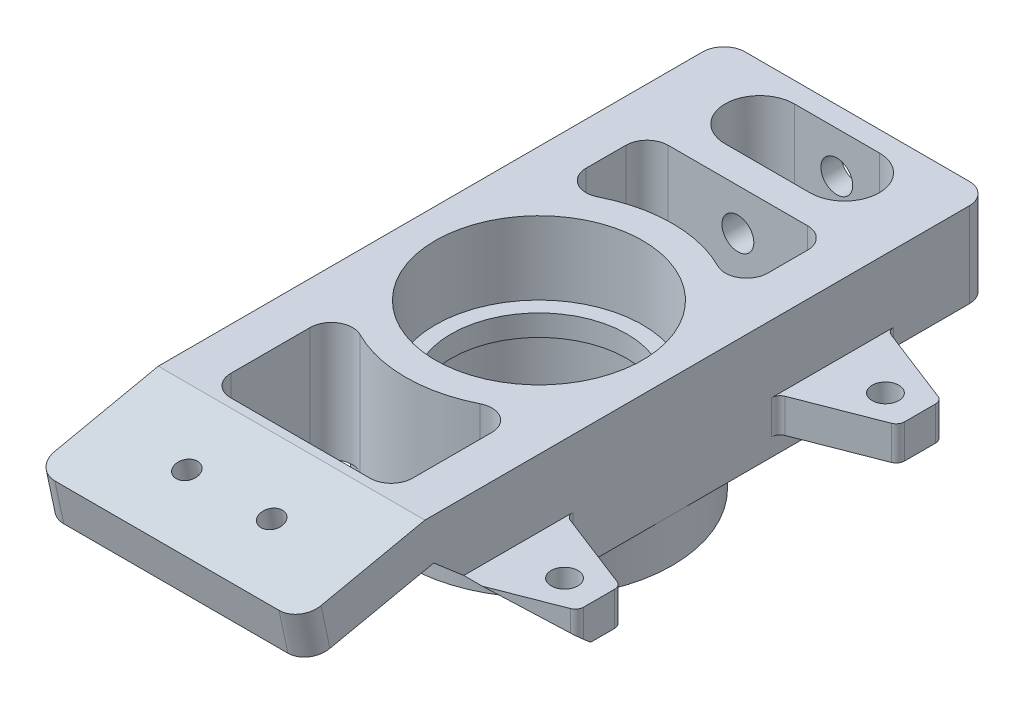
from build123d import *

# Parameters (mm, degrees)
BEARING_FILLET_R         = 6.35
LBJ_PREP_DEPTH           = 35.56
LBJ_EXTRUDE_DEPTH        = 79.756
LBJ_SLOT_DEPTH           = 107.720983645
LBJ_WEIGHT_SAIVNG_REACH  = 111.157
LBJ_FILLET_R             = 6.35
LBJ_HOLE_REACH           = 156.327
SKETCH12_R               = 4.7625
LBJ_WIDENING_DEPTH       = 147.443500502
UBJ_AREA_PREP_DEPTH      = 35.56
UBJ_ANGLE_MOUNT_DEPTH    = 79.756
SKETCH7_R                = 3.2639
CAMBER_BLOCK_HOLES_DEPTH = 12.7
UBJ_WEIGHT_SAVING_REACH  = 125.43
UBJ_FILLETS_R            = 6.35
SKETCH13_R               = 4
BRAKE_ARMS_DEPTH         = 10.16
UPPER_BRAKE_CUT_DEPTH    = 151.749278078
LOWER_BRAKE_CUT_DEPTH    = 151.749278078
FILLET1_R                = 2.54
SKETCH14_R               = 3.175
TIE_ROD_MOUND_DEPTH      = 6.35
FILLET2_R                = 6.35


with BuildPart() as part:
    # Sketch1 → Bearing Housing (revolve)
    with BuildSketch(Plane.XY):
        Polygon((-30.99943, -10.54248), (-30.99943, -32.38648), (-26.289, -32.38648), (-26.289, -38.73648), (-30.99943, -38.73648), (-30.99943, -63.12048), (-32.258, -63.12048), (-32.258, -59.31048), (-39.878, -59.31048), (-39.878, -10.54248), align=None)
    revolve(axis=Axis((0, 0, 0), (0, -1, 0)))

    # Bearing Fillet
    # the kernel refuses this fillet: 6.35 mm, written as the material it adds along each edge
    with BuildSketch(Plane(origin=(0, -59.31048, 0), x_dir=(-1, 0, 0), z_dir=(0, 0, 1))) as bearing_fillet_piece_1:
        with BuildLine():
            CenterArc((38.077871133, 6.35), BEARING_FILLET_R, 203.578178478, 66.421821522)
            Line((38.077871133, 0), (38.077871133, -0.127))
            Line((38.077871133, -0.127), (32.258, -0.127))
            Line((32.258, -0.127), (32.131, 0))
            ThreePointArc((32.131, 0), (32.131, 1.905), (32.141602577, 3.7592))
            Line((32.141602577, 3.7592), (32.258, 3.81))
        make_face()
    revolve(axis=Axis((0, -59.31048, 0), (0, -1, 0)))

    # Sketch2 → LBJ Prep (add)
    with BuildSketch(Plane(origin=(0, -10.54248, 0), x_dir=(-1, 0, 0), z_dir=(0, -1, 0))):
        with BuildLine():
            Line((-39.878, 50.8), (-39.878, 0))
            ThreePointArc((-39.878, 0), (0, 39.878), (39.878, 0))
            Line((39.878, 0), (39.878, 50.8))
            Line((39.878, 50.8), (-39.878, 50.8))
        make_face()
    extrude(amount=LBJ_PREP_DEPTH)

    # Sketch3 → LBJ Extrude (add)
    with BuildSketch(Plane.ZY.offset(39.878)):
        Polygon((-50.8, -10.54248), (-95.1865, -10.54248), (-95.1865, -35.94248), (-58.42, -35.94248), (-50.8, -46.10248), align=None)
    extrude(amount=-LBJ_EXTRUDE_DEPTH)

    # Sketch4 → LBJ Slot (cut, through all)
    with BuildSketch(Plane.XZ.offset(35.94248)):
        with BuildLine():
            Line((-12.7, -68.3895), (12.7, -68.3895))
            ThreePointArc((12.7, -68.3895), (23.0505, -78.74), (12.7, -89.0905))
            Line((12.7, -89.0905), (-12.7, -89.0905))
            ThreePointArc((-12.7, -89.0905), (-23.0505, -78.74), (-12.7, -68.3895))
        make_face()
    extrude(amount=-LBJ_SLOT_DEPTH, mode=Mode.SUBTRACT)

    # Sketch8 → LBJ Weight Saivng (cut, up to next)
    with BuildSketch(Plane.XZ.offset(46.10248), mode=Mode.PRIVATE) as lbj_weight_saivng_sk1:
        with BuildLine():
            Line((-27.178, -29.182378244), (-27.178, -59.4995))
            Line((-27.178, -59.4995), (27.178, -59.4995))
            Line((27.178, -59.4995), (27.178, -29.182378244))
            ThreePointArc((27.178, -29.182378244), (0, -39.878), (-27.178, -29.182378244))
        make_face()
    lbj_weight_saivng_tool1 = extrude(lbj_weight_saivng_sk1.sketch, amount=-LBJ_WEIGHT_SAIVNG_REACH, mode=Mode.PRIVATE) & part.part
    add(lbj_weight_saivng_tool1.solids().sort_by_distance((0, -46.10248, -47.803718))[0], mode=Mode.SUBTRACT)

    # LBJ Fillet
    # the kernel refuses this fillet: 6.35 mm, written as the material it adds along each edge
    with BuildSketch(Plane(origin=(-27.178, -35.94248, -59.4995), x_dir=(0, 0, 1), z_dir=(0, 1, 0))) as lbj_fillet_piece_1_section:
        with BuildLine():
            CenterArc((LBJ_FILLET_R, LBJ_FILLET_R), LBJ_FILLET_R, 180, 90)
            Line((0, LBJ_FILLET_R), (0, 0))
            Line((0, 0), (LBJ_FILLET_R, 0))
        make_face()
    lbj_fillet_piece_1 = extrude(amount=25.4, mode=Mode.PRIVATE)
    lbj_fillet_piece_1 = split(lbj_fillet_piece_1, bisect_by=Plane(origin=(-24.73120958, -35.160405559, -59.00655583), z_dir=(0, -0.6000000000000006, -0.7999999999999996)), keep=Keep.TOP, mode=Mode.PRIVATE)
    add(lbj_fillet_piece_1)
    with BuildSketch(Plane(origin=(-27.178, -51.81748, -59.4995), x_dir=(0, 0, 1), z_dir=(0, 1, 0))) as lbj_fillet_piece_2_section:
        with BuildLine():
            CenterArc((LBJ_FILLET_R, LBJ_FILLET_R), LBJ_FILLET_R, 180, 90)
            Line((0, LBJ_FILLET_R), (0, 0))
            Line((0, 0), (LBJ_FILLET_R, 0))
        make_face()
    lbj_fillet_piece_2 = extrude(amount=41.275, mode=Mode.PRIVATE)
    lbj_fillet_piece_2 = split(lbj_fillet_piece_2, bisect_by=Plane(origin=(-26.809097356, -38.125416815, -56.782797389), z_dir=(0, 0.6000000000000006, 0.7999999999999996)), keep=Keep.TOP, mode=Mode.PRIVATE)
    lbj_fillet_piece_2 = split(lbj_fillet_piece_2, bisect_by=Plane(origin=(-26.809097356, -35.94248, -56.0123491), z_dir=(0, -1, 0)), keep=Keep.TOP, mode=Mode.PRIVATE)
    add(lbj_fillet_piece_2)
    with BuildSketch(Plane(origin=(-27.178, -35.94248, -59.4995), x_dir=(0, 0, 1), z_dir=(0, 1, 0))) as lbj_fillet_piece_3_section:
        with BuildLine():
            CenterArc((LBJ_FILLET_R, LBJ_FILLET_R), LBJ_FILLET_R, 180, 90)
            Line((0, LBJ_FILLET_R), (0, 0))
            Line((0, 0), (LBJ_FILLET_R, 0))
        make_face()
    lbj_fillet_piece_3 = extrude(amount=25.4, mode=Mode.PRIVATE)
    lbj_fillet_piece_3 = split(lbj_fillet_piece_3, bisect_by=Plane(origin=(-25.759204024, -27.852635119, -64.487383661), z_dir=(0, 0.6000000000000006, 0.7999999999999996)), keep=Keep.TOP, mode=Mode.PRIVATE)
    add(lbj_fillet_piece_3)
    with BuildSketch(Plane(origin=(27.178, -35.94248, -59.4995), x_dir=(0, 0, 1), z_dir=(0, 1, 0))) as lbj_fillet_piece_4_section:
        with BuildLine():
            CenterArc((LBJ_FILLET_R, -LBJ_FILLET_R), LBJ_FILLET_R, 90, 90)
            Line((0, -LBJ_FILLET_R), (0, 0))
            Line((0, 0), (LBJ_FILLET_R, 0))
        make_face()
    lbj_fillet_piece_4 = extrude(amount=25.4, mode=Mode.PRIVATE)
    lbj_fillet_piece_4 = split(lbj_fillet_piece_4, bisect_by=Plane(origin=(24.73120958, -35.160405559, -59.00655583), z_dir=(0, -0.6000000000000006, -0.7999999999999996)), keep=Keep.TOP, mode=Mode.PRIVATE)
    add(lbj_fillet_piece_4)
    with BuildSketch(Plane(origin=(27.178, -51.81748, -59.4995), x_dir=(0, 0, 1), z_dir=(0, 1, 0))) as lbj_fillet_piece_5_section:
        with BuildLine():
            CenterArc((LBJ_FILLET_R, -LBJ_FILLET_R), LBJ_FILLET_R, 90, 90)
            Line((0, -LBJ_FILLET_R), (0, 0))
            Line((0, 0), (LBJ_FILLET_R, 0))
        make_face()
    lbj_fillet_piece_5 = extrude(amount=41.275, mode=Mode.PRIVATE)
    lbj_fillet_piece_5 = split(lbj_fillet_piece_5, bisect_by=Plane(origin=(26.809097356, -35.94248, -56.0123491), z_dir=(0, -1, 0)), keep=Keep.TOP, mode=Mode.PRIVATE)
    lbj_fillet_piece_5 = split(lbj_fillet_piece_5, bisect_by=Plane(origin=(26.809097356, -38.125416815, -56.782797389), z_dir=(0, 0.6000000000000006, 0.7999999999999996)), keep=Keep.TOP, mode=Mode.PRIVATE)
    add(lbj_fillet_piece_5)
    with BuildSketch(Plane(origin=(27.178, -35.94248, -59.4995), x_dir=(0, 0, 1), z_dir=(0, 1, 0))) as lbj_fillet_piece_6_section:
        with BuildLine():
            CenterArc((LBJ_FILLET_R, -LBJ_FILLET_R), LBJ_FILLET_R, 90, 90)
            Line((0, -LBJ_FILLET_R), (0, 0))
            Line((0, 0), (LBJ_FILLET_R, 0))
        make_face()
    lbj_fillet_piece_6 = extrude(amount=25.4, mode=Mode.PRIVATE)
    lbj_fillet_piece_6 = split(lbj_fillet_piece_6, bisect_by=Plane(origin=(25.759204024, -27.852635119, -64.487383661), z_dir=(0, 0.6000000000000006, 0.7999999999999996)), keep=Keep.TOP, mode=Mode.PRIVATE)
    add(lbj_fillet_piece_6)
    with BuildSketch(Plane(origin=(27.178, -46.10248, -29.182378244), x_dir=(-0.8204405839916293, 0, -0.5717317973835934), z_dir=(0, 1, 0))) as lbj_fillet_piece_7:
        with BuildLine():
            CenterArc((12.120741225, -6.286772968), LBJ_FILLET_R, 98.09213616, 116.778941593)
            Line((6.910943516, -9.917269881), (0, 0))
            ThreePointArc((0, 0), (5.613440626, -0.397065762), (11.226881252, 0))
        make_face()
    extrude(amount=35.56)
    with BuildSketch(Plane(origin=(-27.178, -46.10248, -29.182378244), x_dir=(0.8204405839916298, 0, -0.5717317973835926), z_dir=(0, 1, 0))) as lbj_fillet_piece_8:
        with BuildLine():
            CenterArc((12.120741225, 6.286772968), LBJ_FILLET_R, 145.128922247, 116.778941593)
            Line((6.910943516, 9.917269881), (0, 0))
            ThreePointArc((0, 0), (5.613440626, 0.397065762), (11.226881252, 0))
        make_face()
    extrude(amount=35.56)

    # LBJ Hole: up to this face of the body (flat: up to its plane)
    lbj_hole_end = Plane(part.part.faces().sort_by_distance((0, -23.24248, -59.4995))[0])
    # Sketch12 → LBJ Hole (cut, up to the picked face)
    with BuildSketch(Plane(origin=(0, 0, -95.1865), x_dir=(-1, 0, 0), z_dir=(0, 0, -1)), mode=Mode.PRIVATE) as lbj_hole_sk1:
        with Locations((0, -22.958000058)):
            Circle(SKETCH12_R)
    lbj_hole_tool1 = split(extrude(lbj_hole_sk1.sketch, amount=-LBJ_HOLE_REACH, mode=Mode.PRIVATE), bisect_by=lbj_hole_end, keep=Keep.BOTH, mode=Mode.PRIVATE)
    add(lbj_hole_tool1.solids().sort_by(Axis((0, -22.958, -95.1865), (0, 0, 1)))[0], mode=Mode.SUBTRACT)

    # Sketch17 → LBJ Widening (cut, through all)
    with BuildSketch(Plane(origin=(0, -22.958000058, -95.1865), x_dir=(-0.7660444431189768, 0.6427876096865408, 0), z_dir=(-0.6427876096865408, -0.7660444431189768, 0))):
        with BuildLine():
            Line((-1.27, -6.096), (1.27, -6.096))
            ThreePointArc((1.27, -6.096), (11.6205, -16.4465), (1.27, -26.797))
            Line((1.27, -26.797), (-1.27, -26.797))
            ThreePointArc((-1.27, -26.797), (-11.6205, -16.4465), (-1.27, -6.096))
        make_face()
    lbj_widening = extrude(amount=LBJ_WIDENING_DEPTH, mode=Mode.SUBTRACT)

    # LBJ Widening 2: LBJ Widening across plane
    add(lbj_widening.mirror(Plane(origin=(0, 0, 0), x_dir=(0, 0, 1), z_dir=(1, 0, 0))), mode=Mode.SUBTRACT)

    # Sketch5 → UBJ Area Prep (add)
    with BuildSketch(Plane(origin=(0, -10.54248, 0), x_dir=(-1, 0, 0), z_dir=(0, -1, 0))):
        with BuildLine():
            Line((-39.878, -44.45), (39.878, -44.45))
            Line((39.878, -44.45), (39.878, 0))
            ThreePointArc((39.878, 0), (0, -39.878), (-39.878, 0))
            Line((-39.878, 0), (-39.878, -44.45))
        make_face()
    extrude(amount=UBJ_AREA_PREP_DEPTH)

    # UBJ Angle → UBJ Angle Mount (add)
    with BuildSketch(Plane.ZY.offset(39.878)):
        Polygon((44.45, -10.54248), (73.998610356, -10.54248), (111.266033944, -18.46391542), (108.62555547, -30.886389949), (71.358131882, -22.964954529), (44.45, -46.10248), align=None)
    extrude(amount=-UBJ_ANGLE_MOUNT_DEPTH)

    # Sketch7 → Camber Block Holes (cut)
    with BuildSketch(Plane(origin=(0, -7.460258703, -1.585726939), x_dir=(1, 0, 0), z_dir=(0, -0.9781476007338056, -0.2079116908177598))):
        with Locations(Location((-12.7, 93.623468019, 0), (0, 0, 270))):
            Circle(SKETCH7_R)
        with Locations(Location((12.7, 93.623468019, 0), (0, 0, 270))):
            Circle(SKETCH7_R)
    extrude(amount=-CAMBER_BLOCK_HOLES_DEPTH, mode=Mode.SUBTRACT)

    # Sketch9 → UBJ Weight Saving (cut, up to next)
    with BuildSketch(Plane.XZ.offset(46.10248), mode=Mode.PRIVATE) as ubj_weight_saving_sk1:
        with BuildLine():
            Line((-27.178, 29.182378244), (-27.178, 71.358131882))
            Line((-27.178, 71.358131882), (27.178, 71.358131882))
            Line((27.178, 71.358131882), (27.178, 29.182378244))
            ThreePointArc((27.178, 29.182378244), (0, 39.878), (-27.178, 29.182378244))
        make_face()
    ubj_weight_saving_tool1 = extrude(ubj_weight_saving_sk1.sketch, amount=-UBJ_WEIGHT_SAVING_REACH, mode=Mode.PRIVATE) & part.part
    add(ubj_weight_saving_tool1.solids().sort_by_distance((0, -46.10248, 53.804717))[0], mode=Mode.SUBTRACT)

    # UBJ Fillets
    ubj_fillets_edges = [part.edges().sort_by_distance(p)[0] for p in [
        (27.178, -16.753717265, 71.358131882),
        (-27.178, -16.753717265, 71.358131882),
        (-27.178, -28.32248, 29.182378244),
        (27.178, -28.32248, 29.182378244),
    ]]
    fillet(ubj_fillets_edges, radius=UBJ_FILLETS_R)

    # Sketch13 → Brake Arms (add)
    # profile 1 of 2: a face of its own
    with BuildSketch(Plane(origin=(0, -30.702480066, 0), x_dir=(1, 0, 0), z_dir=(0, 1, 0))):
        Polygon((65.996800061, -54.35), (65.996800061, -41.65), (39.878, -31.49), (39.878, -64.51), align=None)
        with Locations(Location((55.64680006, -48, 0), (0, 0, 180))):
            Circle(SKETCH13_R, mode=Mode.SUBTRACT)
    # profile 2 of 2: a face of its own
    with BuildSketch(Plane(origin=(0, -30.702480066, 0), x_dir=(1, 0, 0), z_dir=(0, 1, 0))):
        Polygon((39.878, 31.49), (39.878, 64.51), (65.996800061, 54.35), (65.996800061, 41.65), align=None)
        with Locations((55.64680006, 48)):
            Circle(SKETCH13_R, mode=Mode.SUBTRACT)
    extrude(amount=-BRAKE_ARMS_DEPTH)

    # Sketch15 → Upper Brake Cut (cut, through all)
    with BuildSketch(Plane.ZY.offset(-39.878)):
        Polygon((64.51, -28.853465354), (50.543936427, -40.862480066), (64.51, -40.862480066), align=None)
    extrude(amount=-UPPER_BRAKE_CUT_DEPTH, mode=Mode.SUBTRACT)

    # Sketch16 → Lower Brake Cut (cut, through all)
    with BuildSketch(Plane.ZY.offset(-39.878)):
        Polygon((-58.42, -35.94248), (-95.1865, -35.94248), (-95.1865, -46.10248), (-50.8, -46.10248), align=None)
    extrude(amount=-LOWER_BRAKE_CUT_DEPTH, mode=Mode.SUBTRACT)

    # Fillet1
    fillet1_edges = [part.edges().sort_by_distance(p)[0] for p in [
        (65.996800061, -34.146117994, 54.35),
        (65.996800061, -35.782480066, 41.65),
        (65.996800061, -35.782480066, -41.65),
        (65.996800061, -35.782480066, -54.35),
        (39.878, -33.322480033, -64.51),
        (39.878, -35.782480066, -31.49),
        (39.878, -35.782480066, 31.49),
    ]]
    fillet(fillet1_edges, radius=FILLET1_R)

    # Sketch14 → Tie Rod Mound (cut)
    with BuildSketch(Plane.ZY.offset(39.878)):
        with Locations((-31.242, -20.19448)):
            Circle(SKETCH14_R)
        with Locations((-31.242, -37.46648)):
            Circle(SKETCH14_R)
        with Locations((-55.118, -20.19448)):
            Circle(SKETCH14_R)
    extrude(amount=-TIE_ROD_MOUND_DEPTH, mode=Mode.SUBTRACT)

    # Fillet2
    fillet2_edges = [part.edges().sort_by_distance(p)[0] for p in [
        (-39.878, -24.675152685, 109.945794707),
        (39.878, -24.675152685, 109.945794707),
        (-39.878, -23.24248, -95.1865),
        (39.878, -23.24248, -95.1865),
    ]]
    fillet(fillet2_edges, radius=FILLET2_R)


solid = part.part
